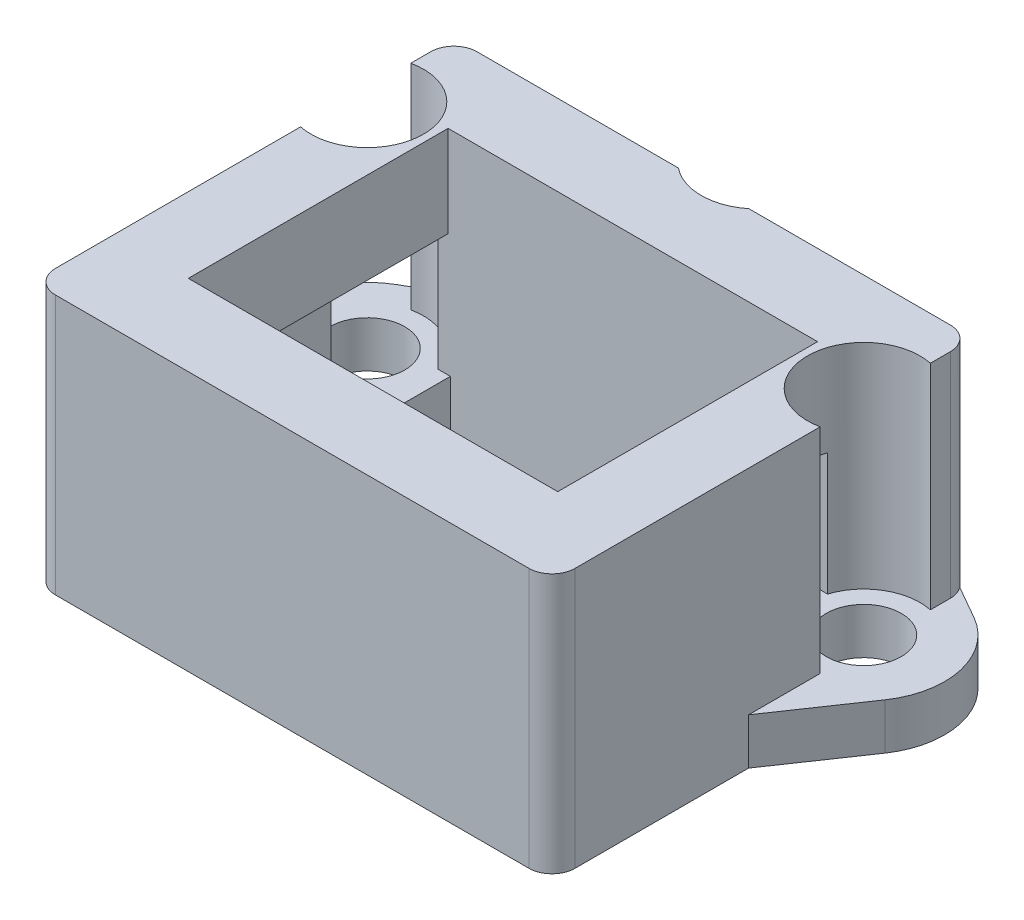
from build123d import *

# Parameters (mm, degrees)
SKETCH2_W           = 45
SKETCH2_H           = 36.5
SKETCH2_W_2         = 32
SKETCH2_H_2         = 22.5
BOSS_EXTRUDE2_DEPTH = 22.5
SKETCH3_W           = 40
SKETCH3_H           = 22.5
CUT_EXTRUDE1_DEPTH  = 33.441832562
SKETCH5_R           = 3.25
BOSS_EXTRUDE3_DEPTH = 4
SKETCH7_R           = 3.25
CUT_EXTRUDE2_DEPTH  = 47.501639756
CUT_EXTRUDE3_START  = -18.5
SKETCH8_R           = 4.875
CUT_EXTRUDE3_DEPTH  = 18.5
FILLET1_R           = 2


with BuildPart() as part:
    # Sketch2 → Boss-Extrude2 (new body)
    with BuildSketch(Plane(origin=(0, 0, 0), x_dir=(1, 0, 0), z_dir=(0, 1, 0))):
        Rectangle(SKETCH2_W, SKETCH2_H)
        Rectangle(SKETCH2_W_2, SKETCH2_H_2, mode=Mode.SUBTRACT)
    extrude(amount=-BOSS_EXTRUDE2_DEPTH)

    # Sketch3 → Cut-Extrude1 (cut, through all)
    with BuildSketch(Plane(origin=(0, -7.9, 0), x_dir=(1, 0, 0), z_dir=(0, 1, 0))):
        Rectangle(SKETCH3_W, SKETCH3_H)
    extrude(amount=-CUT_EXTRUDE1_DEPTH, mode=Mode.SUBTRACT)

    # Sketch5 → Boss-Extrude3 (add)
    with BuildSketch(Plane(origin=(0, -22.5, 0), x_dir=(-1, 0, 0), z_dir=(0, -1, 0))):
        with BuildLine():
            Line((-24.976015549, 15.825962138), (-3.476015549, 28.125962138))
            ThreePointArc((-3.476015549, 28.125962138), (0, 29.05), (3.476015549, 28.125962138))
            Line((3.476015549, 28.125962138), (24.976015549, 15.825962138))
            ThreePointArc((24.976015549, 15.825962138), (28.325069482, 11.305129115), (27.265115511, 5.779679718))
            Line((27.265115511, 5.779679718), (21.8, -2.155957702))
            Line((21.8, -2.155957702), (15.8, -2.155957702))
            Line((15.8, -2.155957702), (15.8, 11.25))
            Line((15.8, 11.25), (-15.8, 11.25))
            Line((-15.8, 11.25), (-15.8, -2.25))
            Line((-15.8, -2.25), (-21.8, -2.25))
            Line((-21.8, -2.25), (-27.28678918, 5.811336396))
            ThreePointArc((-27.28678918, 5.811336396), (-28.320782217, 11.323826531), (-24.976015549, 15.825962138))
        make_face()
        with Locations((21.5, 9.75)):
            Circle(SKETCH5_R, mode=Mode.SUBTRACT)
        with Locations((-21.5, 9.75)):
            Circle(SKETCH5_R, mode=Mode.SUBTRACT)
        with Locations(Location((0, 22.05, 0), (0, 0, 90))):
            Circle(SKETCH5_R, mode=Mode.SUBTRACT)
    extrude(amount=-BOSS_EXTRUDE3_DEPTH)

    # Sketch7 → Cut-Extrude2 (cut, through all)
    with BuildSketch(Plane(origin=(0, -22.5, 0), x_dir=(-1, 0, 0), z_dir=(0, -1, 0))):
        with Locations(Location((-21.5, 9.75, 0), (0, 0, 90))):
            Circle(SKETCH7_R)
        with Locations(Location((0, 22.05, 0), (0, 0, 90))):
            Circle(SKETCH7_R)
        with Locations(Location((21.5, 9.75, 0), (0, 0, 90))):
            Circle(SKETCH7_R)
    extrude(amount=-CUT_EXTRUDE2_DEPTH, mode=Mode.SUBTRACT)

    # Sketch8 → Cut-Extrude3 (cut)
    with BuildSketch(Plane(origin=(0, 0, 0), x_dir=(1, 0, 0), z_dir=(0, 1, 0)).offset(CUT_EXTRUDE3_START)):
        with Locations((0, 22.05)):
            Circle(SKETCH8_R)
        with Locations((-21.5, 9.75)):
            Circle(SKETCH8_R)
        with Locations((21.5, 9.75)):
            Circle(SKETCH8_R)
    extrude(amount=CUT_EXTRUDE3_DEPTH, mode=Mode.SUBTRACT)

    # Fillet1
    # the kernel refuses this fillet: 2 mm, written as the material it takes off along each edge
    with BuildSketch(Plane(origin=(-22.5, 5, -18.25), x_dir=(1, 0, 0), z_dir=(0, -1, 0))) as fillet1_piece_1_section:
        with BuildLine():
            CenterArc((FILLET1_R, FILLET1_R), FILLET1_R, 180, 90)
            Line((0, FILLET1_R), (0, 0))
            Line((0, 0), (FILLET1_R, 0))
        make_face()
    fillet1_piece_1 = extrude(amount=32.5, mode=Mode.PRIVATE)
    fillet1_piece_1 = split(fillet1_piece_1, bisect_by=Plane(origin=(-20.691017739, -18.5, -18.244599527), z_dir=(0, 1, 0)), keep=Keep.TOP, mode=Mode.PRIVATE)
    add(fillet1_piece_1, mode=Mode.SUBTRACT)
    with BuildSketch(Plane(origin=(-22.5, 5, -18.25), x_dir=(1, 0, 0), z_dir=(0, -1, 0))) as fillet1_piece_2_section:
        with BuildLine():
            CenterArc((FILLET1_R, FILLET1_R), FILLET1_R, 180, 90)
            Line((0, FILLET1_R), (0, 0))
            Line((0, 0), (FILLET1_R, 0))
        make_face()
    fillet1_piece_2 = extrude(amount=32.5, mode=Mode.PRIVATE)
    fillet1_piece_2 = split(fillet1_piece_2, bisect_by=Plane(origin=(-21.836723919, -20.5, -17.621928978), z_dir=(-0.49657364983015595, 0, -0.8679945911665335)), keep=Keep.TOP, mode=Mode.PRIVATE)
    add(fillet1_piece_2, mode=Mode.SUBTRACT)
    with BuildSketch(Plane(origin=(22.5, 5, -18.25), x_dir=(0, 0, 1), z_dir=(0, -1, 0))) as fillet1_piece_3_section:
        with BuildLine():
            CenterArc((FILLET1_R, FILLET1_R), FILLET1_R, 180, 90)
            Line((0, FILLET1_R), (0, 0))
            Line((0, 0), (FILLET1_R, 0))
        make_face()
    fillet1_piece_3 = extrude(amount=32.5, mode=Mode.PRIVATE)
    fillet1_piece_3 = split(fillet1_piece_3, bisect_by=Plane(origin=(22.38175336, -18.5, -17.085383577), z_dir=(0, 1, 0)), keep=Keep.TOP, mode=Mode.PRIVATE)
    add(fillet1_piece_3, mode=Mode.SUBTRACT)
    with BuildSketch(Plane(origin=(22.5, 5, -18.25), x_dir=(0, 0, 1), z_dir=(0, -1, 0))) as fillet1_piece_4_section:
        with BuildLine():
            CenterArc((FILLET1_R, FILLET1_R), FILLET1_R, 180, 90)
            Line((0, FILLET1_R), (0, 0))
            Line((0, 0), (FILLET1_R, 0))
        make_face()
    fillet1_piece_4 = extrude(amount=32.5, mode=Mode.PRIVATE)
    fillet1_piece_4 = split(fillet1_piece_4, bisect_by=Plane(origin=(21.836723919, -20.5, -17.621928978), z_dir=(0.49657364983015595, 0, -0.8679945911665338)), keep=Keep.TOP, mode=Mode.PRIVATE)
    add(fillet1_piece_4, mode=Mode.SUBTRACT)
    with BuildSketch(Plane(origin=(-22.5, 5, 18.25), x_dir=(1, 0, 0), z_dir=(0, -1, 0)), Plane(origin=(22.5, 5, 18.25), x_dir=(0, 0, -1), z_dir=(0, -1, 0))) as fillet1_piece_5:
        with BuildLine():
            CenterArc((FILLET1_R, -FILLET1_R), FILLET1_R, 90, 90)
            Line((0, -FILLET1_R), (0, 0))
            Line((0, 0), (FILLET1_R, 0))
        make_face()
    extrude(amount=32.5, mode=Mode.SUBTRACT)


solid = part.part
